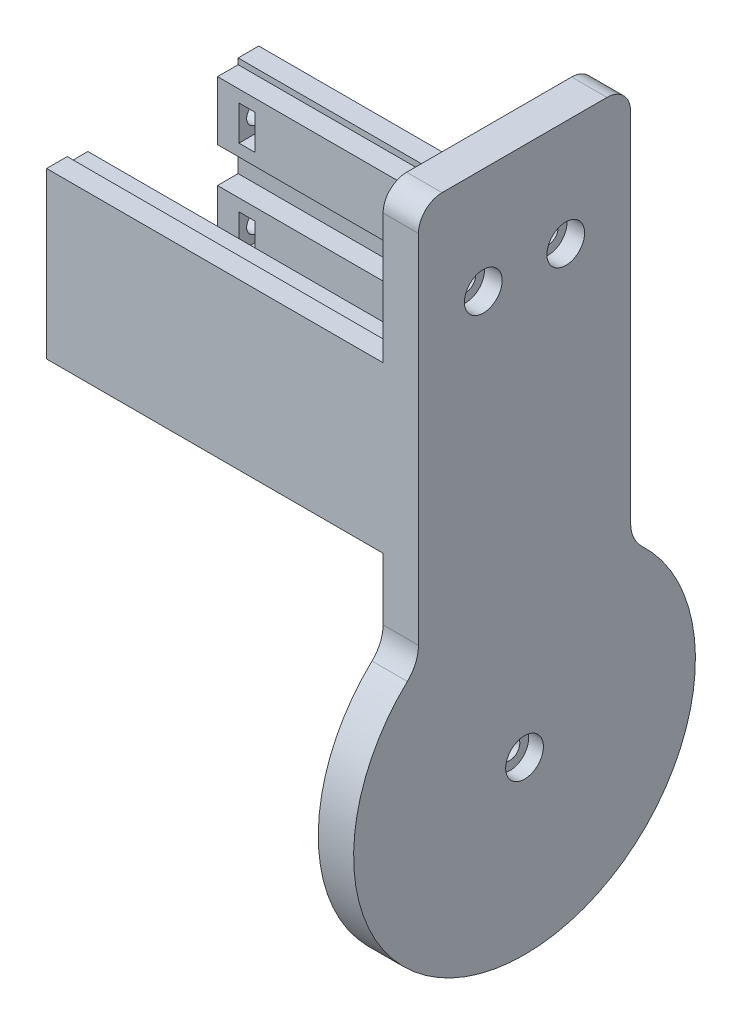
from build123d import *

# Parameters (mm, degrees)
PLATE_START                   = 28.55
PLATE_D_DEPTH                 = 6
BOX_START                     = -28.55
SKETCH2_W                     = 3.5
SKETCH2_H                     = 28
BOX_WALLS_DEPTH               = 57.3
WALL_START                    = -28.55
SKETCH3_W                     = 3.5
SKETCH3_H                     = 10
WALL_BOSSES_DEPTH             = 57.3
HORN_START                    = 28.35
HORN_POCKET_DEPTH             = 2.5
BOLT_START                    = 28.35
SKETCH5_R                     = 1.7
BOLT_HOLES_DEPTH              = 6.4
HUB_START                     = 32.05
SKETCH6_R                     = 3.2
HUB_COUNTERBORE_DEPTH         = 2.7
HEAD_MOUNT_START              = 31.55
SKETCH7_R                     = 3.2
HEAD_MOUNT_COUNTERBORES_DEPTH = 3.2
COVER_START                   = -28.75
SKETCH8_R                     = 1.7
COVER_BOLT_HOLES_DEPTH        = 10.2
COVER_START_2                 = -24.9
COVER_NUT_SLOTS_DEPTH         = 2.7


with BuildPart() as part:
    # Sketch1 → Plate D (new body)
    with BuildSketch(Plane(origin=(0, 0, 0), x_dir=(0, 0, -1), z_dir=(1, 0, 0)).offset(PLATE_START)):
        with BuildLine():
            Line((-32, 227.975478406), (-32, 288.5))
            ThreePointArc((-32, 288.5), (-30.828427125, 291.328427125), (-28, 292.5))
            Line((-28, 292.5), (0, 292.5))
            ThreePointArc((0, 292.5), (2.828427125, 291.328427125), (4, 288.5))
            Line((4, 288.5), (4, 227.975478406))
            ThreePointArc((4, 227.975478406), (4.49156491, 225.597003504), (5.885714286, 223.608253536))
            ThreePointArc((5.885714286, 223.608253536), (-14, 173.5), (-33.885714286, 223.608253536))
            ThreePointArc((-33.885714286, 223.608253536), (-32.49156491, 225.597003504), (-32, 227.975478406))
        make_face()
    extrude(amount=PLATE_D_DEPTH)

    # Sketch2 → Box walls (add)
    with BuildSketch(Plane(origin=(0, 0, 0), x_dir=(0, 0, -1), z_dir=(1, 0, 0)).offset(BOX_START)):
        with Locations((2.25, 252.5)):
            Rectangle(SKETCH2_W, SKETCH2_H)
        with Locations((-30.25, 252.5)):
            Rectangle(SKETCH2_W, SKETCH2_H)
    extrude(amount=BOX_WALLS_DEPTH)

    # Sketch3 → Wall bosses (add)
    with BuildSketch(Plane(origin=(0, 0, 0), x_dir=(0, 0, -1), z_dir=(1, 0, 0)).offset(WALL_START)):
        with Locations((-1.25, 244.5)):
            Rectangle(SKETCH3_W, SKETCH3_H)
        with Locations((-26.75, 244.5)):
            Rectangle(SKETCH3_W, SKETCH3_H)
        with Locations((-1.25, 260.5)):
            Rectangle(SKETCH3_W, SKETCH3_H)
        with Locations((-26.75, 260.5)):
            Rectangle(SKETCH3_W, SKETCH3_H)
    extrude(amount=WALL_BOSSES_DEPTH)

    # Sketch4 → Horn pocket (cut)
    with BuildSketch(Plane(origin=(0, 0, 0), x_dir=(0, 0, -1), z_dir=(1, 0, 0)).offset(HORN_START)):
        with BuildLine():
            Line((-18.4, 179.4), (-18.4, 225.6))
            ThreePointArc((-18.4, 225.6), (-14, 230), (-9.6, 225.6))
            Line((-9.6, 225.6), (-9.6, 179.4))
            ThreePointArc((-9.6, 179.4), (-14, 175), (-18.4, 179.4))
        make_face()
    extrude(amount=HORN_POCKET_DEPTH, mode=Mode.SUBTRACT)

    # Sketch5 → Bolt holes (cut)
    with BuildSketch(Plane(origin=(0, 0, 0), x_dir=(0, 0, -1), z_dir=(1, 0, 0)).offset(BOLT_START)):
        with Locations((-14, 202.5)):
            Circle(SKETCH5_R)
        with Locations((-7, 274.5)):
            Circle(SKETCH5_R)
        with Locations((-21, 274.5)):
            Circle(SKETCH5_R)
    extrude(amount=BOLT_HOLES_DEPTH, mode=Mode.SUBTRACT)

    # Sketch6 → Hub counterbore (cut)
    with BuildSketch(Plane(origin=(0, 0, 0), x_dir=(0, 0, -1), z_dir=(1, 0, 0)).offset(HUB_START)):
        with Locations((-14, 202.5)):
            Circle(SKETCH6_R)
    extrude(amount=HUB_COUNTERBORE_DEPTH, mode=Mode.SUBTRACT)

    # Sketch7 → Head-mount counterbores (cut)
    with BuildSketch(Plane(origin=(0, 0, 0), x_dir=(0, 0, -1), z_dir=(1, 0, 0)).offset(HEAD_MOUNT_START)):
        with Locations((-7, 274.5)):
            Circle(SKETCH7_R)
        with Locations((-21, 274.5)):
            Circle(SKETCH7_R)
    extrude(amount=HEAD_MOUNT_COUNTERBORES_DEPTH, mode=Mode.SUBTRACT)

    # Sketch8 → Cover bolt holes (cut)
    with BuildSketch(Plane(origin=(0, 0, 0), x_dir=(0, 0, -1), z_dir=(1, 0, 0)).offset(COVER_START)):
        with Locations((0, 244.5)):
            Circle(SKETCH8_R)
        with Locations((-28, 244.5)):
            Circle(SKETCH8_R)
        with Locations((0, 260.5)):
            Circle(SKETCH8_R)
        with Locations((-28, 260.5)):
            Circle(SKETCH8_R)
    extrude(amount=COVER_BOLT_HOLES_DEPTH, mode=Mode.SUBTRACT)

    # Sketch9 → Cover nut slots (cut)
    with BuildSketch(Plane(origin=(0, 0, 0), x_dir=(0, 0, -1), z_dir=(1, 0, 0)).offset(COVER_START_2)):
        Polygon((-1.703183294, 241.55), (1.703183294, 241.55), (3.406366588, 244.5), (1.703183294, 247.45), (-1.703183294, 247.45), (-3.4, 247.45), (-3.4, 241.55), align=None)
        Polygon((-26.296816706, 247.45), (-29.703183294, 247.45), (-31.406366588, 244.5), (-29.703183294, 241.55), (-26.296816706, 241.55), (-24.6, 241.55), (-24.6, 247.45), align=None)
        Polygon((-1.703183294, 257.55), (1.703183294, 257.55), (3.406366588, 260.5), (1.703183294, 263.45), (-1.703183294, 263.45), (-3.4, 263.45), (-3.4, 257.55), align=None)
        Polygon((-26.296816706, 263.45), (-29.703183294, 263.45), (-31.406366588, 260.5), (-29.703183294, 257.55), (-26.296816706, 257.55), (-24.6, 257.55), (-24.6, 263.45), align=None)
    extrude(amount=COVER_NUT_SLOTS_DEPTH, mode=Mode.SUBTRACT)


solid = part.part
